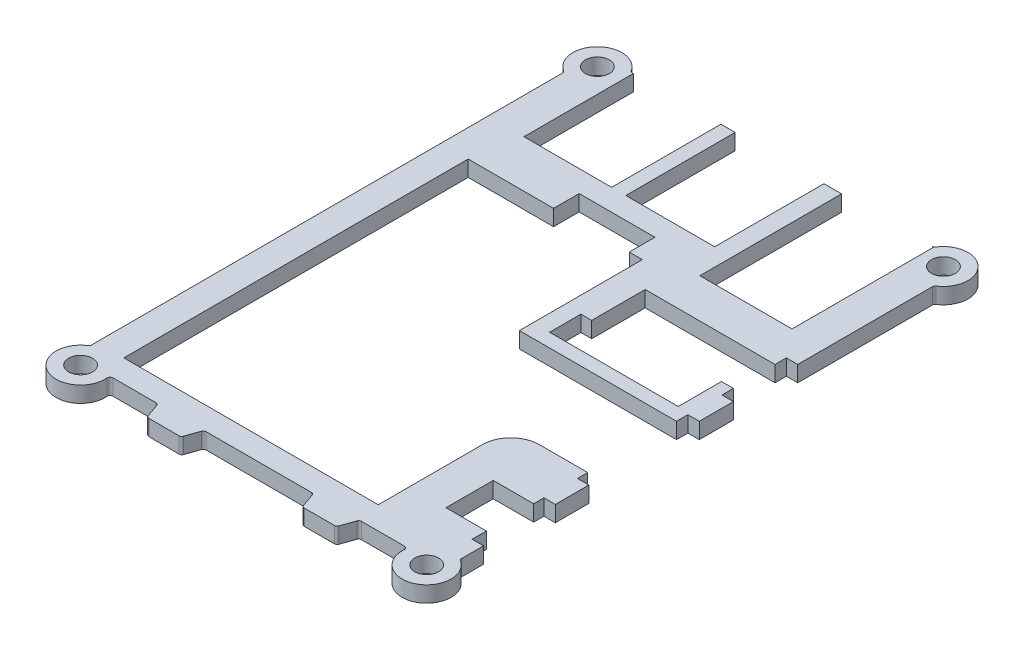
from build123d import *

# Parameters (mm, degrees)
BASEPLATE_OUTLINE_R = 2.1
BASEPLATE_DEPTH     = 2.8
CUT_EXTRUDE1_REACH  = 115.438
SKETCH3_W           = 15.4
SKETCH3_H           = 19.2
SKETCH3_W_2         = 15.6
SKETCH3_W_3         = 16.2
SKETCH3_H_2         = 24.9
CUT_EXTRUDE2_REACH  = 115.438
FILLET1_R           = 5


# Read off the part's stored shape, not the designer's step: BasePlate
with BuildPart() as part:
    # BasePlate outline → BasePlate (new body)
    with BuildSketch(Plane(origin=(0, 0, 0), x_dir=(1, 0, 0), z_dir=(0, 1, 0))):
        with BuildLine():
            Line((43.502626614, -5.852332608), (48.792614178, -5.852332608))
            ThreePointArc((48.792614178, -5.852332608), (49.082078508, -5.760021707), (49.264659986, -5.517174213))
            Line((49.264659986, -5.517174213), (50.078201202, -3.187491002))
            ThreePointArc((50.078201202, -3.187491002), (50.26078268, -2.944643509), (50.55024701, -2.852332608))
            Line((50.55024701, -2.852332608), (58.116695703, -2.852332608))
            ThreePointArc((58.116695703, -2.852332608), (58.484685739, -3.013831008), (58.614956567, -3.393999275))
            ThreePointArc((58.614956567, -3.393999275), (64.799237397, -7.61016844), (65.229166667, -0.137781095))
            ThreePointArc((65.229166667, -0.137781095), (65.061014427, 0.043158816), (65, 0.282515593))
            Line((65, 0.282515593), (65, 83.012819192))
            ThreePointArc((65, 83.012819192), (65.061014427, 83.252175969), (65.229166667, 83.433115879))
            ThreePointArc((65.229166667, 83.433115879), (65.940559159, 90.088226551), (59.285448487, 89.376834059))
            ThreePointArc((59.285448487, 89.376834059), (59.104508577, 89.208681819), (58.8651518, 89.147667392))
            Line((58.8651518, 89.147667392), (6.1348482, 89.147667392))
            ThreePointArc((6.1348482, 89.147667392), (5.895491423, 89.208681819), (5.714551513, 89.376834059))
            ThreePointArc((5.714551513, 89.376834059), (-0.940559159, 90.088226551), (-0.229166667, 83.433115879))
            ThreePointArc((-0.229166667, 83.433115879), (-0.061014427, 83.252175969), (0, 83.012819192))
            Line((0, 83.012819192), (0, 0.282515593))
            ThreePointArc((0, 0.282515593), (-0.061014427, 0.043158816), (-0.229166667, -0.137781095))
            ThreePointArc((-0.229166667, -0.137781095), (0.200762603, -7.61016844), (6.385043433, -3.393999275))
            ThreePointArc((6.385043433, -3.393999275), (6.515314261, -3.013831008), (6.883304297, -2.852332608))
            Line((6.883304297, -2.852332608), (14.44975299, -2.852332608))
            ThreePointArc((14.44975299, -2.852332608), (14.73921732, -2.944643509), (14.921798798, -3.187491002))
            Line((14.921798798, -3.187491002), (15.735340014, -5.517174213))
            ThreePointArc((15.735340014, -5.517174213), (15.917921492, -5.760021707), (16.207385822, -5.852332608))
            Line((16.207385822, -5.852332608), (21.497373386, -5.852332608))
            ThreePointArc((21.497373386, -5.852332608), (21.786837716, -5.760021707), (21.969419194, -5.517174213))
            Line((21.969419194, -5.517174213), (22.78296041, -3.187491002))
            ThreePointArc((22.78296041, -3.187491002), (22.965541888, -2.944643509), (23.255006218, -2.852332608))
            Line((23.255006218, -2.852332608), (41.744993782, -2.852332608))
            ThreePointArc((41.744993782, -2.852332608), (42.034458112, -2.944643509), (42.21703959, -3.187491002))
            Line((42.21703959, -3.187491002), (43.030580806, -5.517174213))
            ThreePointArc((43.030580806, -5.517174213), (43.213162284, -5.760021707), (43.502626614, -5.852332608))
        make_face()
        with Locations((2.1, -3.752332608)):
            Circle(BASEPLATE_OUTLINE_R, mode=Mode.SUBTRACT)
        with Locations((62.9, -3.752332608)):
            Circle(BASEPLATE_OUTLINE_R, mode=Mode.SUBTRACT)
        with Locations((2.1, 87.047667392)):
            Circle(BASEPLATE_OUTLINE_R, mode=Mode.SUBTRACT)
        with Locations((62.9, 87.047667392)):
            Circle(BASEPLATE_OUTLINE_R, mode=Mode.SUBTRACT)
    extrude(amount=BASEPLATE_DEPTH)

    # Sketch3 → Cut-Extrude1 (cut, up to next)
    with BuildSketch(Plane(origin=(0, 2.8, 0), x_dir=(1, 0, 0), z_dir=(0, 1, 0)), mode=Mode.PRIVATE) as cut_extrude1_sk1:
        Polygon((4.8, 1.147667392), (49.5, 1.147667392), (49.5, 24.447667392), (63, 24.447667392), (63, 22.647667392), (65, 22.647667392), (65, 42.047667392), (63, 42.047667392), (63, 40.047667392), (35.4, 40.047667392), (35.4, 61.647667392), (33.1, 61.647667392), (33.1, 66.147667392), (19.8, 66.147667392), (19.8, 61.647667392), (4.8, 61.647667392), align=None)
    cut_extrude1_tool1 = extrude(cut_extrude1_sk1.sketch, amount=-CUT_EXTRUDE1_REACH, mode=Mode.PRIVATE) & part.part
    # Sketch3 → Cut-Extrude1 (cut, up to next)
    with BuildSketch(Plane(origin=(0, 2.8, 0), x_dir=(1, 0, 0), z_dir=(0, 1, 0)), mode=Mode.PRIVATE) as cut_extrude1_sk2:
        Polygon((55.9, 6.647667392), (63, 6.647667392), (63, 4.147667392), (65, 4.147667392), (65, 16.747667392), (63, 16.747667392), (63, 14.947667392), (55.9, 14.947667392), align=None)
    cut_extrude1_tool2 = extrude(cut_extrude1_sk2.sketch, amount=-CUT_EXTRUDE1_REACH, mode=Mode.PRIVATE) & part.part
    # Sketch3 → Cut-Extrude1 (cut, up to next)
    with BuildSketch(Plane(origin=(0, 2.8, 0), x_dir=(1, 0, 0), z_dir=(0, 1, 0)), mode=Mode.PRIVATE) as cut_extrude1_sk3:
        with Locations((14, 79.547667392)):
            Rectangle(SKETCH3_W, SKETCH3_H)
    cut_extrude1_tool3 = extrude(cut_extrude1_sk3.sketch, amount=-CUT_EXTRUDE1_REACH, mode=Mode.PRIVATE) & part.part
    # Sketch3 → Cut-Extrude1 (cut, up to next)
    with BuildSketch(Plane(origin=(0, 2.8, 0), x_dir=(1, 0, 0), z_dir=(0, 1, 0)), mode=Mode.PRIVATE) as cut_extrude1_sk4:
        with Locations((32, 79.547667392)):
            Rectangle(SKETCH3_W_2, SKETCH3_H)
    cut_extrude1_tool4 = extrude(cut_extrude1_sk4.sketch, amount=-CUT_EXTRUDE1_REACH, mode=Mode.PRIVATE) & part.part
    # Sketch3 → Cut-Extrude1 (cut, up to next)
    with BuildSketch(Plane(origin=(0, 2.8, 0), x_dir=(1, 0, 0), z_dir=(0, 1, 0)), mode=Mode.PRIVATE) as cut_extrude1_sk5:
        with Locations((51, 76.697667392)):
            Rectangle(SKETCH3_W_3, SKETCH3_H_2)
    cut_extrude1_tool5 = extrude(cut_extrude1_sk5.sketch, amount=-CUT_EXTRUDE1_REACH, mode=Mode.PRIVATE) & part.part
    add(cut_extrude1_tool1.solids().sort_by_distance((28.204461, 2.8, -30.008726))[0], mode=Mode.SUBTRACT)
    add(cut_extrude1_tool2.solids().sort_by_distance((60.812891, 2.8, -10.69283))[0], mode=Mode.SUBTRACT)
    add(cut_extrude1_tool3.solids().sort_by_distance((14, 2.8, -79.547667))[0], mode=Mode.SUBTRACT)
    add(cut_extrude1_tool4.solids().sort_by_distance((32, 2.8, -79.547667))[0], mode=Mode.SUBTRACT)
    add(cut_extrude1_tool5.solids().sort_by_distance((51, 2.8, -76.697667))[0], mode=Mode.SUBTRACT)

    # Sketch4 → Cut-Extrude2 (cut, up to next)
    with BuildSketch(Plane(origin=(0, 2.8, 0), x_dir=(1, 0, 0), z_dir=(0, 1, 0)), mode=Mode.PRIVATE) as cut_extrude2_sk1:
        Polygon((65, 59.347667392), (63, 59.347667392), (63, 57.347667392), (40.2, 57.347667392), (40.2, 47.947667392), (38.3, 47.947667392), (38.3, 42.447667392), (60.9, 42.447667392), (60.9, 50.047667392), (63, 50.047667392), (63, 48.047667392), (65, 48.047667392), align=None)
    cut_extrude2_tool1 = extrude(cut_extrude2_sk1.sketch, amount=-CUT_EXTRUDE2_REACH, mode=Mode.PRIVATE) & part.part
    add(cut_extrude2_tool1.solids().sort_by_distance((51.560754, 2.8, -50.163969))[0], mode=Mode.SUBTRACT)

    # Fillet1
    fillet1_edges = [part.edges().sort_by_distance(p)[0] for p in [
        (49.5, 1.4, -24.447667392),
    ]]
    fillet(fillet1_edges, radius=FILLET1_R)


solid = part.part
